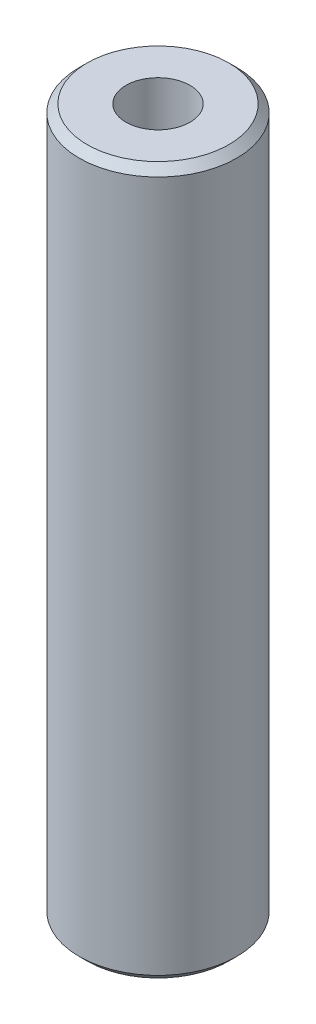
from build123d import *

# Parameters (mm, degrees)
SKETCH1_R           = 60
BOSS_EXTRUDE1_DEPTH = 539.247639649
SKETCH2_R           = 24.400057006
CUT_EXTRUDE1_DEPTH  = 546.882786747
CHAMFER1_SIZE       = 5.971866269


with BuildPart() as part:
    # Sketch1 → Boss-Extrude1 (new body)
    with BuildSketch(Plane(origin=(0, 0, 0), x_dir=(1, 0, 0), z_dir=(0, 1, 0))):
        Circle(SKETCH1_R)
    extrude(amount=BOSS_EXTRUDE1_DEPTH)

    # Sketch2 → Cut-Extrude1 (cut, through all)
    with BuildSketch(Plane(origin=(0, 0, 0), x_dir=(1, 0, 0), z_dir=(0, 1, 0))):
        Circle(SKETCH2_R)
    extrude(amount=CUT_EXTRUDE1_DEPTH, mode=Mode.SUBTRACT)

    # Chamfer1
    chamfer1_edges = [part.edges().sort_by_distance(p)[0] for p in [
        (-60, 539.247639649, 0),
        (-60, 0, 0),
    ]]
    chamfer(chamfer1_edges, length=CHAMFER1_SIZE)


solid = part.part
